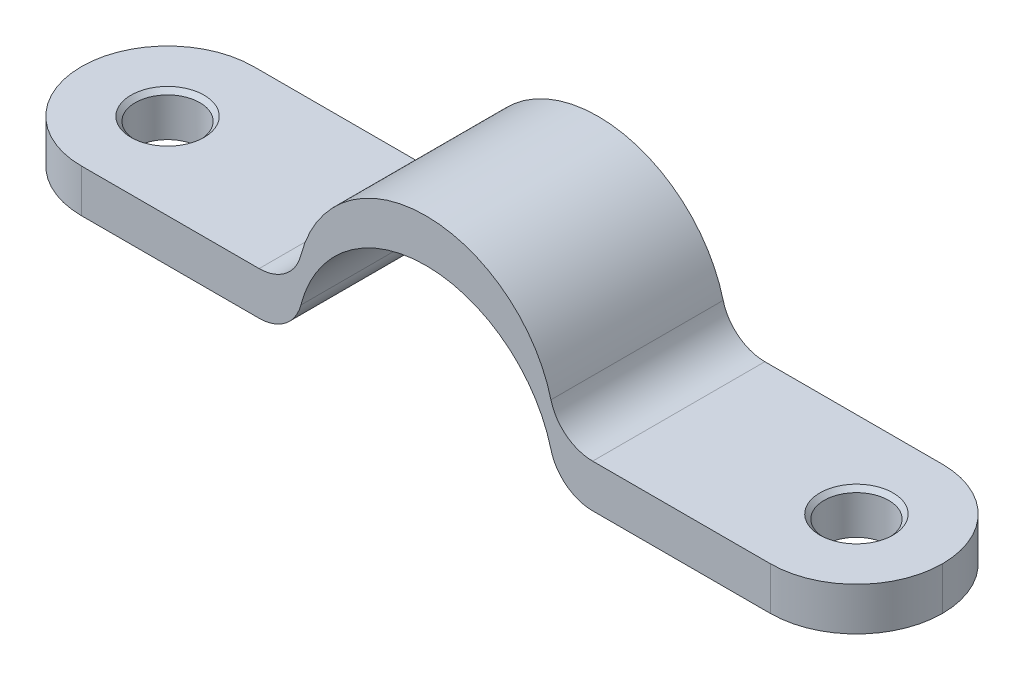
from build123d import *

# Parameters (mm, degrees)
BOSS_EXTRUDE1_DEPTH = 40
FILLET1_R           = 20
SKETCH4_R           = 7.5
CUT_EXTRUDE1_DEPTH  = 40
CHAMFER1_SIZE       = 1


with BuildPart() as part:
    # Sketch3 → Boss-Extrude1 (new body)
    with BuildSketch(Plane.XY):
        with BuildLine():
            Line((-38.729833462, -5), (-100, -5))
            Line((-100, -5), (-100, 5))
            Line((-100, 5), (-38.729833462, 5))
            ThreePointArc((-38.729833462, 5), (-32.606109105, 7.09430585), (-29.047375097, 12.5))
            ThreePointArc((-29.047375097, 12.5), (0, 35), (29.047375097, 12.5))
            ThreePointArc((29.047375097, 12.5), (32.606109105, 7.09430585), (38.729833462, 5))
            Line((38.729833462, 5), (100, 5))
            Line((100, 5), (100, -5))
            Line((100, -5), (38.729833462, -5))
            ThreePointArc((38.729833462, -5), (32.606109105, -2.90569415), (29.047375097, 2.5))
            ThreePointArc((29.047375097, 2.5), (0, 25), (-29.047375097, 2.5))
            ThreePointArc((-29.047375097, 2.5), (-32.606109105, -2.90569415), (-38.729833462, -5))
        make_face()
    extrude(amount=BOSS_EXTRUDE1_DEPTH)

    # Fillet1
    fillet1_edges = [part.edges().sort_by_distance(p)[0] for p in [
        (100, 0, 0),
        (100, 0, 40),
        (-100, 0, 0),
        (-100, 0, 40),
    ]]
    fillet(fillet1_edges, radius=FILLET1_R - 0.0001)  # a hair under: the kernel refuses the full size

    # Sketch4 → Cut-Extrude1 (cut)
    with BuildSketch(Plane(origin=(0, 5, 0), x_dir=(1, 0, 0), z_dir=(0, 1, 0))):
        with Locations(Location((80, -20, 0), (0, 0, 180))):
            Circle(SKETCH4_R)
        with Locations(Location((-80, -20, 0), (0, 0, 180))):
            Circle(SKETCH4_R)
    extrude(amount=-CUT_EXTRUDE1_DEPTH, mode=Mode.SUBTRACT)

    # Chamfer1
    chamfer1_edges = [part.edges().sort_by_distance(p)[0] for p in [
        (87.5, 5, 20),
        (-72.5, 5, 20),
    ]]
    chamfer(chamfer1_edges, length=CHAMFER1_SIZE)


solid = part.part
